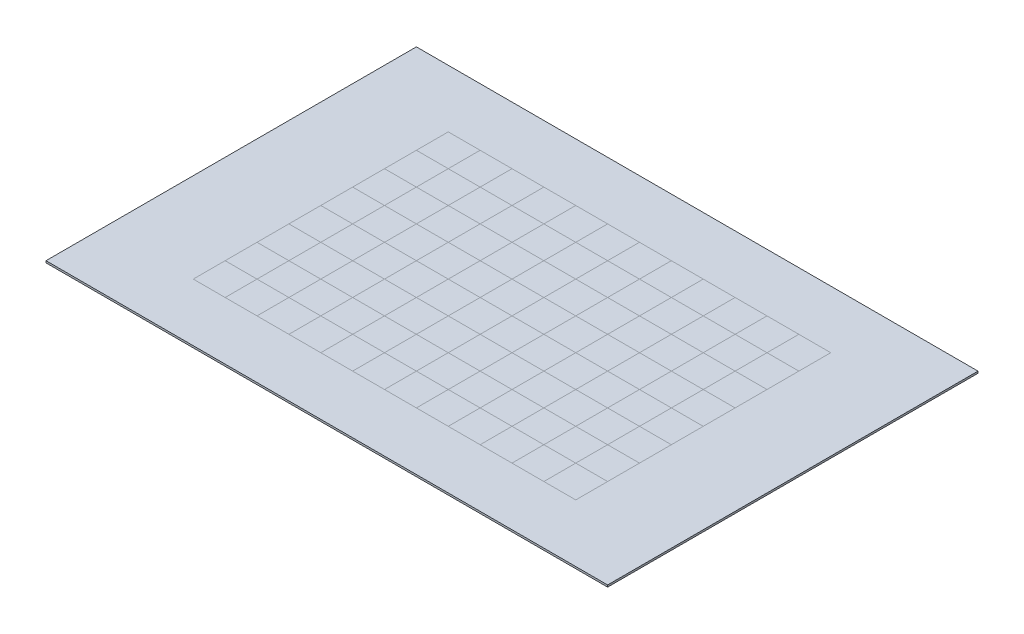
from build123d import *

# Parameters (mm, degrees)
SKETCH2_W           = 881
SKETCH2_H           = 581
BOSS_EXTRUDE1_DEPTH = 3


with BuildPart() as part:
    # Sketch2 → Boss-Extrude1 (new body)
    with BuildSketch(Plane(origin=(0, 0, 0), x_dir=(1, 0, 0), z_dir=(0, 1, 0))):
        Rectangle(SKETCH2_W, SKETCH2_H)
    extrude(amount=BOSS_EXTRUDE1_DEPTH)


solid = part.part
